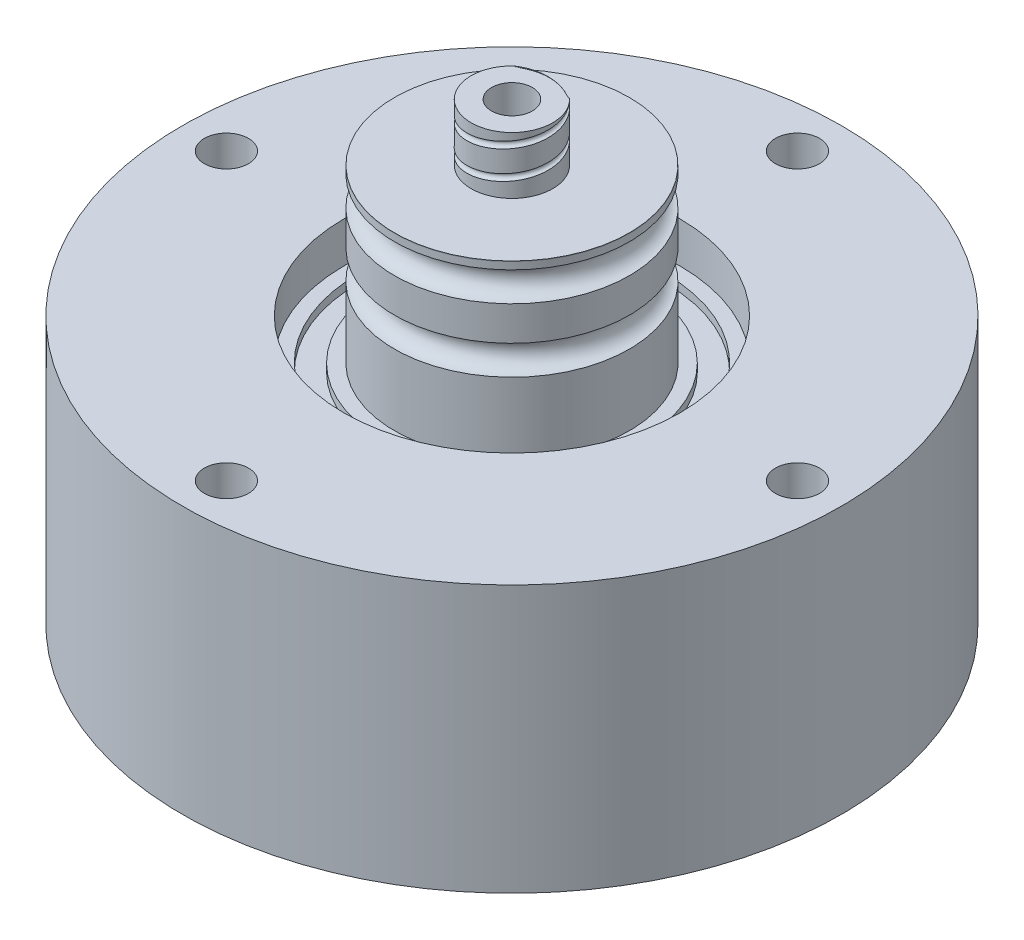
from build123d import *

# Parameters (mm, degrees)
CUT_SWEEP1_PITCH   = 4.38
SKETCH23_R         = 3.429
CUT_EXTRUDE1_DEPTH = 84.794211234
CIRPATTERN1_COUNT  = 4


with BuildPart() as part:
    # Sketch2 → Revolve2 (revolve)
    with BuildSketch(Plane(origin=(0, 0, 0), x_dir=(0, 0, -1), z_dir=(1, 0, 0))):
        with BuildLine():
            Line((8.915435541, 33.02), (18.278227083, 33.02))
            ThreePointArc((18.278227083, 33.02), (18.285544906, 32.985450941), (18.288, 32.950220834))
            Line((18.288, 32.950220834), (18.288, 31.828471157))
            ThreePointArc((18.288, 31.828471157), (16.002, 29.542471157), (18.288, 27.256471157))
            Line((18.288, 27.256471157), (18.288, 21.929131456))
            ThreePointArc((18.288, 21.929131456), (16.002, 19.643131456), (18.288, 17.357131456))
            Line((18.288, 17.357131456), (18.288, 6.35))
            Line((18.288, 6.35), (20.4089, 6.35))
            Line((20.4089, 6.35), (20.4089, 5.08))
            Line((20.4089, 5.08), (23.9649, 5.08))
            Line((23.9649, 5.08), (23.9649, 6.35))
            Line((23.9649, 6.35), (26.162, 6.35))
            Line((26.162, 6.35), (26.162, 12.7))
            Line((26.162, 12.7), (51.308, 12.7))
            Line((51.308, 12.7), (51.308, 0))
            Line((51.308, 0), (51.308, -28.866424571))
            Line((51.308, -28.866424571), (37.338, -28.866424571))
            ThreePointArc((37.338, -28.866424571), (35.541948776, -28.122475795), (34.798, -26.326424571))
            Line((34.798, -26.326424571), (34.798, -16.508739853))
            ThreePointArc((34.798, -16.508739853), (24.727959014, -2.273992307), (7.506184264, -5.002405335))
            Line((7.506184264, -5.002405335), (5.849257761, -6.435927387))
            Line((5.849257761, -6.435927387), (5.849257761, -9.816424571))
            Line((5.849257761, -9.816424571), (6.686966257, -9.816424571))
            ThreePointArc((6.686966257, -9.816424571), (6.895470551, -9.925366103), (6.925118332, -10.158739853))
            Line((6.925118332, -10.158739853), (5.874657825, -12.991424571))
            Line((5.874657825, -12.991424571), (5.874657825, -16.201450646))
            Line((5.874657825, -16.201450646), (6.636130716, -16.201450646))
            ThreePointArc((6.636130716, -16.201450646), (6.844635011, -16.310392178), (6.874282791, -16.543765928))
            Line((6.874282791, -16.543765928), (5.823822285, -19.376450646))
            Line((5.823822285, -19.376450646), (5.823822285, -22.551450646))
            Line((5.823822285, -22.551450646), (6.747225505, -22.551450646))
            ThreePointArc((6.747225505, -22.551450646), (6.926830627, -22.625845524), (7.001225505, -22.805450646))
            Line((7.001225505, -22.805450646), (7.001225505, -28.647450646))
            ThreePointArc((7.001225505, -28.647450646), (6.926830627, -28.827055769), (6.747225505, -28.901450646))
            Line((6.747225505, -28.901450646), (3.191225505, -28.901450646))
            Line((3.191225505, -28.901450646), (3.216661045, -3.501450646))
            Line((3.216661045, -3.501450646), (3.175, 25.364973925))
            Line((3.175, 25.364973925), (3.175, 38.064973925))
            Line((3.175, 38.064973925), (3.175, 41.91))
            Line((3.175, 41.91), (6.35, 41.91))
            Line((6.35, 41.91), (6.35, 33.02))
            Line((6.35, 33.02), (8.915435541, 33.02))
        make_face()
    revolve(axis=Axis((0, 0, 0), (0, 1, 0)))

    # Cut-Sweep1: arcs per turn and ends read off the stored shape
    # Cut-Sweep1: the profile of Cut-Sweep1 profile screwed along a right-hand helix through 3 turns, 12 arcs to a turn; built about Z, then put on its axis
    cut_sweep1_z = Axis((0, 0, 0), (0, 0, 1))
    cut_sweep1_corners = [(6.35, 0.056820727, -4.89759047), (5.8293, 0, -4.38), (6.35, -0.056820727, -3.86240953), (6.8707, 0, -4.38)]
    with BuildLine(mode=Mode.PRIVATE) as cut_sweep1_profile:
        ThreePointArc((6.35, 0.056820727, -4.89759047), (5.981809499, 0.040178322, -4.745991731), (5.8293, 0, -4.38))
        ThreePointArc((5.8293, 0, -4.38), (5.981809499, -0.040178322, -4.014008269), (6.35, -0.056820727, -3.86240953))
        ThreePointArc((6.35, -0.056820727, -3.86240953), (6.718190501, -0.040178322, -4.014008269), (6.8707, 0, -4.38))
        ThreePointArc((6.8707, 0, -4.38), (6.718190501, 0.040178322, -4.745991731), (6.35, 0.056820727, -4.89759047))
    cut_sweep1_cap = Face(cut_sweep1_profile.wire())
    cut_sweep1_arcs = [((6.35, 0.056820727, -4.89759047), (5.8293, 0.056820727, -4.89759047), (5.8293, 0, -4.38), (1, 0.7071067811865476, 1)), ((5.8293, 0, -4.38), (5.8293, -0.056820727, -3.86240953), (6.35, -0.056820727, -3.86240953), (1, 0.7071067811865476, 1)), ((6.35, -0.056820727, -3.86240953), (6.8707, -0.056820727, -3.86240953), (6.8707, 0, -4.38), (1, 0.7071067811865476, 1)), ((6.8707, 0, -4.38), (6.8707, 0.056820727, -4.89759047), (6.35, 0.056820727, -4.89759047), (1, 0.7071067811865476, 1))]  # start, shoulder, end, weights
    cut_sweep1_turn_angles = [0, 15, 30, 45, 60, 75, 90, 105, 120, 135, 150, 165, 180, 195, 210, 225, 240, 255, 270, 285, 300, 315, 330, 345, 360]
    cut_sweep1_turn_weights = [1, 0.9659258262890683, 1, 0.9659258262890683, 1, 0.9659258262890683, 1, 0.9659258262890683, 1, 0.9659258262890683, 1, 0.9659258262890683, 1, 0.9659258262890683, 1, 0.9659258262890683, 1, 0.9659258262890683, 1, 0.9659258262890683, 1, 0.9659258262890683, 1, 0.9659258262890683, 1]
    cut_sweep1_turn_sides = [Face.make_bezier_surface([[Vector(p[j][0], p[j][1], 0).rotate(cut_sweep1_z, cut_sweep1_turn_angles[2 * i + k]) / cut_sweep1_turn_weights[2 * i + k] + Vector(0, 0, p[j][2] + CUT_SWEEP1_PITCH * cut_sweep1_turn_angles[2 * i + k] / 360) for k in range(3)] for j in range(3)], [[p[3][j] * cut_sweep1_turn_weights[2 * i + k] for k in range(3)] for j in range(3)]) for p in cut_sweep1_arcs for i in range(12)]
    cut_sweep1 = Plane(origin=(0, 41.91, 0), x_dir=(0, 0, -1), z_dir=(0, -1, 0)) * Solid(Shell([*[p.moved(Location((0, 0, CUT_SWEEP1_PITCH * i))) for i in range(3) for p in cut_sweep1_turn_sides], cut_sweep1_cap, cut_sweep1_cap.rotate(cut_sweep1_z, 1080).moved(Location((0, 0, CUT_SWEEP1_PITCH * 1080 / 360)))]))
    add(cut_sweep1, mode=Mode.SUBTRACT)

    # Sketch23 → Cut-Extrude1 (cut, symmetric)
    with BuildSketch(Plane(origin=(0, 0, 0), x_dir=(1, 0, 0), z_dir=(0, 1, 0))):
        with Locations(Location((0, 44.45, 0), (0, 0, 270))):
            Circle(SKETCH23_R)
    cut_extrude1 = extrude(amount=CUT_EXTRUDE1_DEPTH, both=True, mode=Mode.SUBTRACT)

    # CirPattern1: Cut-Extrude1 ×4 about axis
    cirpattern1_axis = Axis((0, 0, 0), (0, 1, 0))
    for i in range(1, CIRPATTERN1_COUNT):
        add(cut_extrude1.rotate(cirpattern1_axis, i * 360 / CIRPATTERN1_COUNT), mode=Mode.SUBTRACT)


solid = part.part
